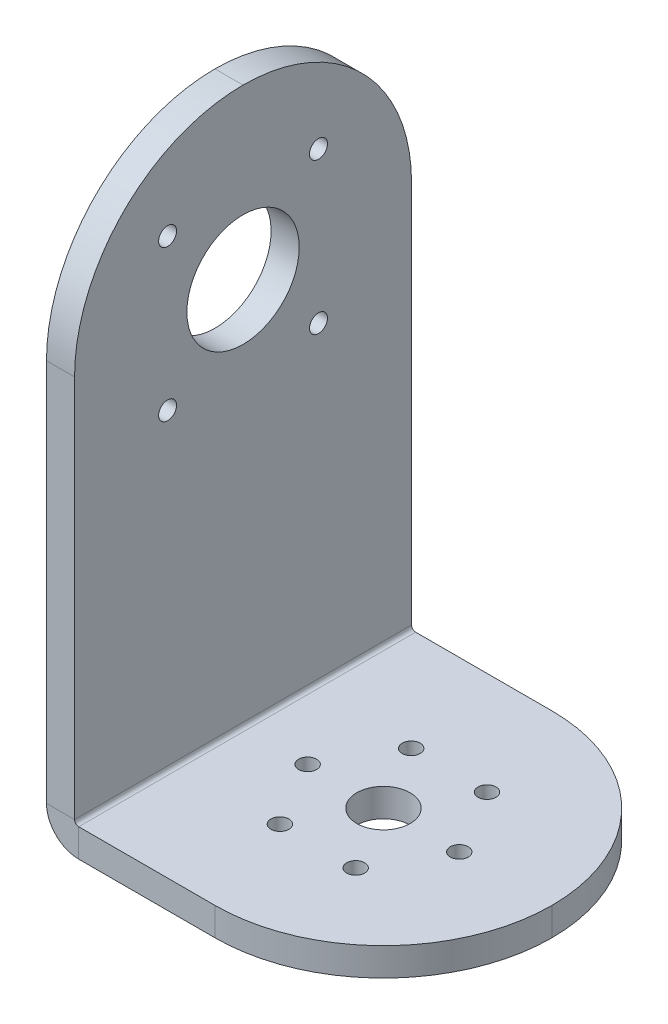
from build123d import *

# Parameters (mm, degrees)
SM_BASE_FLANGE_1_DEPTH  = 30
FILLET_1_R              = 30
SKETCH_2_R              = 4.75
CUT_EXTRUDE_1_DEPTH     = 10
HOLE_WIZARD_1_OUTLINE_R = 1.6
HOLE_WIZARD_1_DEPTH     = 5
SKETCH_5_R              = 10
CUT_EXTRUDE_2_DEPTH     = 10
HOLE_WIZARD_2_OUTLINE_R = 1.6
HOLE_WIZARD_2_DEPTH     = 5


# Read off the part's stored shape, not the designer's step: 孔1, 孔2
# Sheet-metal steps are written as plain solids
with BuildPart() as part:
    # Sketch 1 → 基体-法兰1 (new, symmetric)
    with BuildSketch(Plane.XY):
        with BuildLine():
            Line((60, 0), (5.7366, 0))
            ThreePointArc((5.7366, 0), (1.680211239, 1.680211239), (0, 5.7366))
            Line((0, 5.7366), (0, 104))
            Line((0, 104), (5, 104))
            Line((5, 104), (5, 5.7366))
            ThreePointArc((5, 5.7366), (5.215745145, 5.215745145), (5.7366, 5))
            Line((5.7366, 5), (60, 5))
            Line((60, 5), (60, 0))
        make_face()
    extrude(amount=SM_BASE_FLANGE_1_DEPTH, both=True)

    # 圆角1
    fillet_1_edges = [part.edges().sort_by_distance(p)[0] for p in [
        (60, 2.5, -30),
        (60, 2.5, 30),
        (2.5, 104, -30),
        (2.5, 104, 30),
    ]]
    fillet(fillet_1_edges, radius=FILLET_1_R - 0.0001)  # a hair under: the kernel refuses the full size

    # Sketch 2 → 切除-拉伸1 (cut)
    with BuildSketch(Plane(origin=(0, 5, 0), x_dir=(1, 0, 0), z_dir=(0, 1, 0))):
        with Locations(Location((30, 0, 0), (0, 0, 180))):
            Circle(SKETCH_2_R)
    extrude(amount=-CUT_EXTRUDE_1_DEPTH, mode=Mode.SUBTRACT)

    # 孔1 outline → 孔1 (cut)
    with BuildSketch(Plane(origin=(0, 0, 0), x_dir=(1, 0, 0), z_dir=(0, 1, 0))):
        with Locations((23.25, -11.691342951)):
            Circle(HOLE_WIZARD_1_OUTLINE_R)
        with Locations((16.5, 0)):
            Circle(HOLE_WIZARD_1_OUTLINE_R)
        with Locations((23.25, 11.691342951)):
            Circle(HOLE_WIZARD_1_OUTLINE_R)
        with Locations((36.75, 11.691342951)):
            Circle(HOLE_WIZARD_1_OUTLINE_R)
        with Locations((43.5, 0)):
            Circle(HOLE_WIZARD_1_OUTLINE_R)
        with Locations((36.75, -11.691342951)):
            Circle(HOLE_WIZARD_1_OUTLINE_R)
    extrude(amount=HOLE_WIZARD_1_DEPTH, mode=Mode.SUBTRACT)

    # 草图5 → 切除-拉伸2 (cut)
    with BuildSketch(Plane.ZY):
        with Locations(Location((0, 74, 0), (0, 0, 270))):
            Circle(SKETCH_5_R)
    extrude(amount=-CUT_EXTRUDE_2_DEPTH, mode=Mode.SUBTRACT)

    # 孔2 outline → 孔2 (cut)
    with BuildSketch(Plane.YZ):
        with Locations((60.564971157, 13.435028843)):
            Circle(HOLE_WIZARD_2_OUTLINE_R)
        with Locations((60.564971157, -13.435028843)):
            Circle(HOLE_WIZARD_2_OUTLINE_R)
        with Locations((87.435028843, -13.435028843)):
            Circle(HOLE_WIZARD_2_OUTLINE_R)
        with Locations((87.435028843, 13.435028843)):
            Circle(HOLE_WIZARD_2_OUTLINE_R)
    extrude(amount=HOLE_WIZARD_2_DEPTH, mode=Mode.SUBTRACT)


solid = part.part
